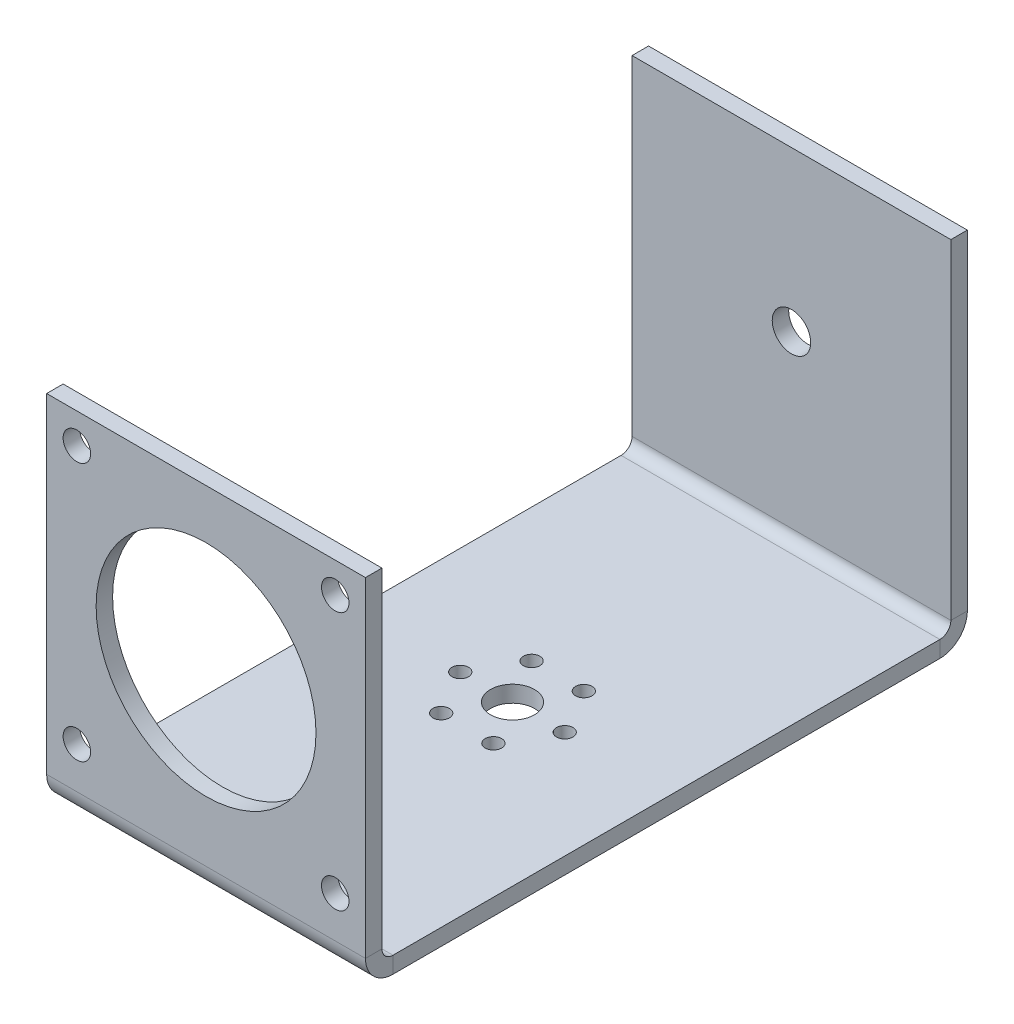
from build123d import *

# Parameters (mm, degrees)
BOSS_EXTRUDE1_DEPTH    = 58
SKETCH25_R             = 4
CUT_EXTRUDE6_DEPTH     = 10
SKETCH26_W             = 103.5
SKETCH26_H             = 2
CUT_EXTRUDE7_DEPTH     = 90
SKETCH29_R             = 1.5
CUT_EXTRUDE8_DEPTH     = 10
CONVERT_SOLID1_DEPTH   = 58
CONVERT_SOLID1_2_DEPTH = 58
SKETCH2_R              = 2.5
SKETCH2_R_2            = 20
CUT_EXTRUDE10_DEPTH    = 10
SKETCH30_R             = 3.5
CUT_EXTRUDE11_DEPTH    = 10


# Read off the part's stored shape, not the designer's step: Convert-Solid1
with BuildPart() as part:
    # Sketch1 → Boss-Extrude1 (new body)
    with BuildSketch(Plane(origin=(0, 0, 0), x_dir=(0, 0, -1), z_dir=(1, 0, 0))):
        Polygon((-73.351671883, 30.400809615), (-73.351671883, -29.599190385), (30.148328117, -29.599190385), (30.148328117, 30.400809615), (33.148328117, 30.400809615), (33.148328117, -34.599190385), (-76.351671883, -34.599190385), (-76.351671883, 30.400809615), align=None)
    extrude(amount=BOSS_EXTRUDE1_DEPTH)

    # Sketch25 → Cut-Extrude6 (cut)
    with BuildSketch(Plane.XZ.offset(34.599190385)):
        with Locations(Location((29, 20.601671883, 0), (0, 0, 270))):
            Circle(SKETCH25_R)
    extrude(amount=-CUT_EXTRUDE6_DEPTH, mode=Mode.SUBTRACT)

    # Sketch26 → Cut-Extrude7 (cut)
    with BuildSketch(Plane(origin=(58, 0, 0), x_dir=(0, 0, -1), z_dir=(1, 0, 0))):
        with Locations((-21.601671883, -30.599190385)):
            Rectangle(SKETCH26_W, SKETCH26_H)
    extrude(amount=-CUT_EXTRUDE7_DEPTH, mode=Mode.SUBTRACT)

    # Sketch29 → Cut-Extrude8 (cut)
    with BuildSketch(Plane(origin=(0, -31.599190385, 0), x_dir=(1, 0, 0), z_dir=(0, 1, 0))):
        with Locations(Location((19.5, -20.601671883, 0), (0, 0, 270))):
            Circle(SKETCH29_R)
        with Locations(Location((24.25, -12.374430547, 0), (0, 0, 270))):
            Circle(SKETCH29_R)
        with Locations(Location((33.75, -12.374430547, 0), (0, 0, 270))):
            Circle(SKETCH29_R)
        with Locations(Location((38.5, -20.601671883, 0), (0, 0, 270))):
            Circle(SKETCH29_R)
        with Locations(Location((33.75, -28.828913219, 0), (0, 0, 270))):
            Circle(SKETCH29_R)
        with Locations(Location((24.25, -28.828913219, 0), (0, 0, 270))):
            Circle(SKETCH29_R)
    extrude(amount=-CUT_EXTRUDE8_DEPTH, mode=Mode.SUBTRACT)

    # Convert-Solid1 outline → Convert-Solid1 (cut)
    with BuildSketch(Plane.YZ):
        with BuildLine():
            Line((-34.599190385, -33.148328117), (-29.599190385, -33.148328117))
            ThreePointArc((-29.599190385, -33.148328117), (-33.134724291, -31.683862023), (-34.599190385, -28.148328117))
            Line((-34.599190385, -28.148328117), (-34.599190385, -33.148328117))
        make_face()
        with BuildLine():
            Line((-34.599190385, 76.351671883), (-34.599190385, 71.351671883))
            ThreePointArc((-34.599190385, 71.351671883), (-33.134724291, 74.887205789), (-29.599190385, 76.351671883))
            Line((-29.599190385, 76.351671883), (-34.599190385, 76.351671883))
        make_face()
    extrude(amount=CONVERT_SOLID1_DEPTH, mode=Mode.SUBTRACT)

    # Convert-Solid1 2 outline → Convert-Solid1 2 (add)
    with BuildSketch(Plane.YZ):
        with BuildLine():
            Line((-31.599190385, -30.148328117), (-29.599190385, -30.148328117))
            ThreePointArc((-29.599190385, -30.148328117), (-31.013403947, -29.56254168), (-31.599190385, -28.148328117))
            Line((-31.599190385, -28.148328117), (-31.599190385, -30.148328117))
        make_face()
        with BuildLine():
            Line((-31.599190385, 73.351671883), (-31.599190385, 71.351671883))
            ThreePointArc((-31.599190385, 71.351671883), (-31.013403947, 72.765885445), (-29.599190385, 73.351671883))
            Line((-29.599190385, 73.351671883), (-31.599190385, 73.351671883))
        make_face()
    extrude(amount=CONVERT_SOLID1_2_DEPTH)

    # Sketch2 → Cut-Extrude10 (cut)
    with BuildSketch(Plane.XY.offset(76.351671883)):
        with Locations((5.5, 24.900809615)):
            Circle(SKETCH2_R)
        with Locations(Location((52.5, 24.900809615, 0), (0, 0, 270))):
            Circle(SKETCH2_R)
        with Locations((52.5, -22.099190385)):
            Circle(SKETCH2_R)
        with Locations(Location((5.5, -22.099190385, 0), (0, 0, 270))):
            Circle(SKETCH2_R)
        with Locations((29, 1.400809615)):
            Circle(SKETCH2_R_2)
    extrude(amount=-CUT_EXTRUDE10_DEPTH, mode=Mode.SUBTRACT)

    # Sketch30 → Cut-Extrude11 (cut)
    with BuildSketch(Plane(origin=(0, 0, -33.148328117), x_dir=(-1, 0, 0), z_dir=(0, 0, -1))):
        with Locations((-29, 1.400809615)):
            Circle(SKETCH30_R)
    extrude(amount=-CUT_EXTRUDE11_DEPTH, mode=Mode.SUBTRACT)


solid = part.part
